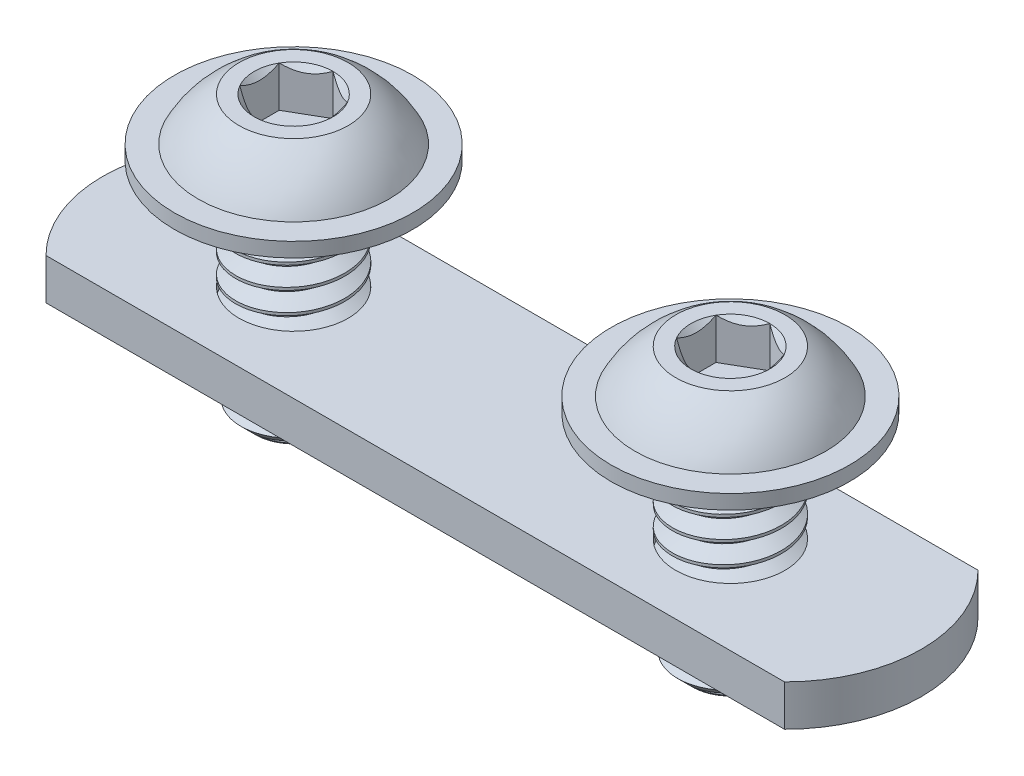
from build123d import *

# Parameters (mm, degrees)
SKETCH1_R           = 3.175
BOSS_EXTRUDE1_DEPTH = 12.7
CUT_SWEEP1_PITCH    = 1.27
SKETCH4_OUTSIDE_W   = 14
SKETCH4_OUTSIDE_H   = 14
SKETCH4_OUTSIDE_R   = 2.21262927
CUT_EXTRUDE1_DEPTH  = 1.27
CUT_EXTRUDE1_DRAFT  = -45
CUT_EXTRUDE2_DEPTH  = 2.38125
BOSS_EXTRUDE2_START = -6.35
SKETCH8_R           = 3.175
BOSS_EXTRUDE2_DEPTH = 2.3876
SKETCH9_R           = 3.5687
SKETCH9_R_2         = 3.175
BOSS_EXTRUDE3_DEPTH = 0.762


with BuildPart() as part:
    # Sketch1 → Boss-Extrude1 (new body)
    with BuildSketch(Plane(origin=(0, 0, 0), x_dir=(1, 0, 0), z_dir=(0, 1, 0))):
        with Locations(Location((-12.7, 0, 0), (0, 0, 270))):
            Circle(SKETCH1_R)
    extrude(amount=-BOSS_EXTRUDE1_DEPTH)

    # Cut-Sweep1: the profile of Sketch3 screwed along a right-hand helix of 11 turns, 8 arcs to a turn; built about Z, then put on its axis
    cut_sweep1_z = Axis((0, 0, 0), (0, 0, 1))
    cut_sweep1_corners = [(2.350110803, 0, -0.47625), (3.243740766, 0, 0.0396875), (3.243740766, 0, -1.1509375), (2.350110803, 0, -0.635)]
    with BuildLine(mode=Mode.PRIVATE) as cut_sweep1_profile:
        Line(cut_sweep1_corners[0], cut_sweep1_corners[1])
        Line(cut_sweep1_corners[1], cut_sweep1_corners[2])
        Line(cut_sweep1_corners[2], cut_sweep1_corners[3])
        Line(cut_sweep1_corners[3], cut_sweep1_corners[0])
    cut_sweep1_cap = Face(cut_sweep1_profile.wire())
    cut_sweep1_turn_angles = [0, 22.5, 45, 67.5, 90, 112.5, 135, 157.5, 180, 202.5, 225, 247.5, 270, 292.5, 315, 337.5, 360]
    cut_sweep1_turn_weights = [1, 0.9238795325112867, 1, 0.9238795325112867, 1, 0.9238795325112867, 1, 0.9238795325112867, 1, 0.9238795325112867, 1, 0.9238795325112867, 1, 0.9238795325112867, 1, 0.9238795325112867, 1]
    cut_sweep1_turn_rails = [Edge.make_bspline([Vector(p[0], p[1], 0).rotate(cut_sweep1_z, cut_sweep1_turn_angles[k]) / cut_sweep1_turn_weights[k] + Vector(0, 0, p[2] + CUT_SWEEP1_PITCH * cut_sweep1_turn_angles[k] / 360) for k in range(17)], [0, 0, 0, 1, 1, 2, 2, 3, 3, 4, 4, 5, 5, 6, 6, 7, 7, 8, 8, 8], 2, cut_sweep1_turn_weights) for p in cut_sweep1_corners]
    cut_sweep1_turn_sides = [Face.make_surface_from_curves(cut_sweep1_turn_rails[p[0]], cut_sweep1_turn_rails[p[1]]) for p in [(0, 1), (1, 2), (2, 3), (3, 0)]]
    cut_sweep1 = Plane(origin=(-12.7, -12.7, 0), x_dir=(0, 0, -1), z_dir=(0, 1, 0)) * Solid(Shell([*[p.moved(Location((0, 0, CUT_SWEEP1_PITCH * i))) for i in range(11) for p in cut_sweep1_turn_sides], cut_sweep1_cap, cut_sweep1_cap.rotate(cut_sweep1_z, 3960).moved(Location((0, 0, CUT_SWEEP1_PITCH * 3960 / 360)))]))
    add(cut_sweep1, mode=Mode.SUBTRACT)


with BuildPart() as cut_extrude1_tool:
    # Sketch4 outside → Cut-Extrude1 (with draft: the straight prism first)
    with BuildSketch(Plane.XZ.offset(12.7)):
        with Locations((-12.7, 0)):
            Rectangle(SKETCH4_OUTSIDE_W, SKETCH4_OUTSIDE_H)
        with Locations((-12.7, 0)):
            Circle(SKETCH4_OUTSIDE_R, mode=Mode.SUBTRACT)
    extrude(amount=-CUT_EXTRUDE1_DEPTH)
    # Cut-Extrude1: the draft: its side faces are tilted about the plane it starts from
    cut_extrude1_sides = [cut_extrude1_tool.faces().sort_by_distance(p)[0] for p in [
        (-12.7, -12.065, -7),
        (-5.7, -12.065, 0),
        (-12.7, -12.065, 7),
        (-19.7, -12.065, 0),
        (-14.91262927, -12.065, 0),
    ]]
    draft(cut_extrude1_sides, Plane.XZ.offset(12.7), CUT_EXTRUDE1_DRAFT)


with BuildPart() as part_1:
    add(part.part)

    # Cut-Extrude1: cut by cut_extrude1_tool
    add(cut_extrude1_tool.part, mode=Mode.SUBTRACT)

    # Sketch5 → Revolve1 (revolve)
    with BuildSketch(Plane.XY, mode=Mode.PRIVATE) as revolve1_sk:
        with BuildLine():
            Line((-12.7, 0), (-12.7, 3.3528))
            Line((-12.7, 3.3528), (-15.875, 3.3528))
            ThreePointArc((-15.875, 3.3528), (-17.240019085, 2.263204136), (-18.2499, 0.8382))
            Line((-18.2499, 0.8382), (-19.6342, 0.8382))
            Line((-19.6342, 0.8382), (-19.6342, 0))
            Line((-19.6342, 0), (-12.7, 0))
        make_face()
    revolve(revolve1_sk.sketch.rotate(Axis((-12.7, 0, 0), (0, 1, 0)), 270), axis=Axis((-12.7, 0, 0), (0, 1, 0)))

    # Sketch6 → Cut-Extrude2 (cut)
    with BuildSketch(Plane(origin=(0, 3.3528, 0), x_dir=(1, 0, 0), z_dir=(0, 1, 0))):
        Polygon((-12.7, 2.291358881), (-14.684375, 1.14567944), (-14.684375, -1.14567944), (-12.7, -2.291358881), (-10.715625, -1.14567944), (-10.715625, 1.14567944), align=None)
    extrude(amount=-CUT_EXTRUDE2_DEPTH, mode=Mode.SUBTRACT)

    # Cut-Extrude3 cone 1 section (through the dimple's axis) → Cut-Extrude3 (revolve, cut)
    with BuildSketch(Plane(origin=(-12.7, 3.3528, 0), x_dir=(0, 0, 1), z_dir=(1, 0, 0))):
        Polygon((0, 0), (2.291358881, 0), (0, 2.291358881), align=None)
    revolve(axis=Axis((-12.7, 3.3528, 0), (0, -1, 0)), mode=Mode.SUBTRACT)


with BuildPart() as body_2:
    # Body-Move/Copy1: copy of part
    add(part_1.part.moved(Location((25.4, 0, 0))))


with BuildPart() as body_3:
    # Sketch8 → Boss-Extrude2 (new body)
    with BuildSketch(Plane(origin=(0, 0, 0), x_dir=(1, 0, 0), z_dir=(0, 1, 0)).offset(BOSS_EXTRUDE2_START)):
        with BuildLine():
            Line((-21.474187891, 5.6261), (21.474187891, 5.6261))
            ThreePointArc((21.474187891, 5.6261), (23.8125, 0), (21.474187891, -5.6261))
            Line((21.474187891, -5.6261), (-21.474187891, -5.6261))
            ThreePointArc((-21.474187891, -5.6261), (-23.8125, 0), (-21.474187891, 5.6261))
        make_face()
        with Locations(Location((-12.7, 0, 0), (0, 0, 270))):
            Circle(SKETCH8_R, mode=Mode.SUBTRACT)
        with Locations(Location((12.7, 0, 0), (0, 0, 270))):
            Circle(SKETCH8_R, mode=Mode.SUBTRACT)
    extrude(amount=-BOSS_EXTRUDE2_DEPTH)

    # Sketch9 → Boss-Extrude3 (add)
    # profile 1 of 2: a face of its own
    with BuildSketch(Plane.XZ.offset(8.7376)):
        with Locations(Location((-12.7, 0, 0), (0, 0, 90))):
            Circle(SKETCH9_R)
        with Locations(Location((-12.7, 0, 0), (0, 0, 90))):
            Circle(SKETCH9_R_2, mode=Mode.SUBTRACT)
    # profile 2 of 2: a face of its own
    with BuildSketch(Plane.XZ.offset(8.7376)):
        with Locations(Location((12.7, 0, 0), (0, 0, 90))):
            Circle(SKETCH9_R)
        with Locations(Location((12.7, 0, 0), (0, 0, 90))):
            Circle(SKETCH9_R_2, mode=Mode.SUBTRACT)
    extrude(amount=BOSS_EXTRUDE3_DEPTH)


solid = Compound([part_1.part, body_2.part, body_3.part])
